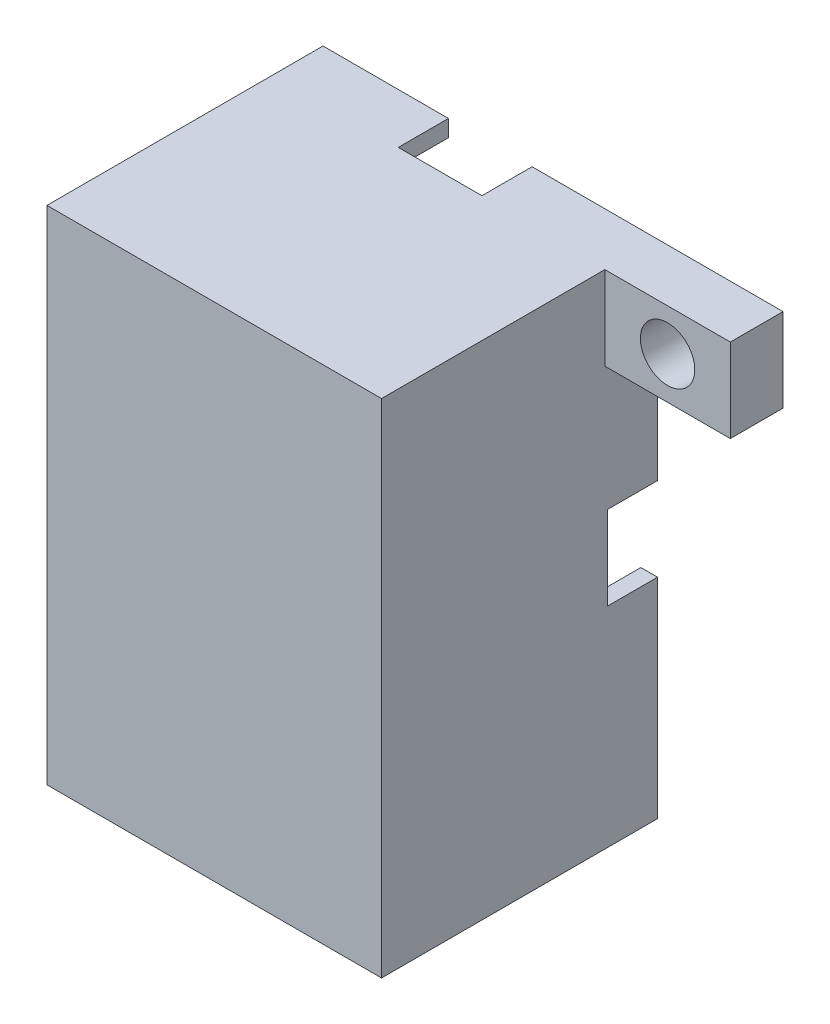
from build123d import *

# Parameters (mm, degrees)
SKETCH1_W               = 20
SKETCH1_H               = 30
SKETCH1_W_2             = 18
SKETCH1_H_2             = 28
BOSS_EXTRUDE1_DEPTH     = 15
SKETCH2_W               = 20
SKETCH2_H               = 30
BOSS_EXTRUDE2_DEPTH     = 1.5
SKETCH3_W               = 7.5
SKETCH3_H               = 5
SKETCH3_R               = 1.625
BOSS_EXTRUDE3_DEPTH     = 3.15
CUT_EXTRUDE1_DEPTH      = 44.914690025
CUT_EXTRUDE1_DEPTH_BACK = 44.914690025
SKETCH4_W               = 3
SKETCH4_H               = 5
CUT_EXTRUDE2_DEPTH      = 44.914690025
CUT_EXTRUDE2_DEPTH_BACK = 44.914690025
SKETCH5_W               = 5
SKETCH5_H               = 3


with BuildPart() as part:
    # Sketch1 → Boss-Extrude1 (new body)
    with BuildSketch(Plane.XY):
        with Locations((10, 15)):
            Rectangle(SKETCH1_W, SKETCH1_H)
        with Locations((10, 15)):
            Rectangle(SKETCH1_W_2, SKETCH1_H_2, mode=Mode.SUBTRACT)
    extrude(amount=BOSS_EXTRUDE1_DEPTH)

    # Sketch2 → Boss-Extrude2 (add)
    with BuildSketch(Plane.XY.offset(15)):
        with Locations((10, 15)):
            Rectangle(SKETCH2_W, SKETCH2_H)
    extrude(amount=BOSS_EXTRUDE2_DEPTH)

    # Sketch3 → Boss-Extrude3 (add)
    with BuildSketch(Plane(origin=(0, 0, 0), x_dir=(-1, 0, 0), z_dir=(0, 0, -1))):
        with Locations((-23.75, 27.5)):
            Rectangle(SKETCH3_W, SKETCH3_H)
        with Locations((-23.75, 27.5)):
            Circle(SKETCH3_R, mode=Mode.SUBTRACT)
    extrude(amount=-BOSS_EXTRUDE3_DEPTH)

    # Sketch4 → Cut-Extrude1 (cut, two sides: drawn at the far end of the back side and taken through both)
    with BuildSketch(Plane.ZY.offset(-CUT_EXTRUDE1_DEPTH_BACK)):
        with Locations((1.5, 15)):
            Rectangle(SKETCH4_W, SKETCH4_H)
    extrude(amount=CUT_EXTRUDE1_DEPTH + CUT_EXTRUDE1_DEPTH_BACK, mode=Mode.SUBTRACT)

    # Sketch5 → Cut-Extrude2 (cut, two sides: drawn at the far end of the back side and taken through both)
    with BuildSketch(Plane.XZ.offset(-CUT_EXTRUDE2_DEPTH_BACK)):
        with Locations((10, 1.5)):
            Rectangle(SKETCH5_W, SKETCH5_H)
    extrude(amount=CUT_EXTRUDE2_DEPTH + CUT_EXTRUDE2_DEPTH_BACK, mode=Mode.SUBTRACT)


solid = part.part
